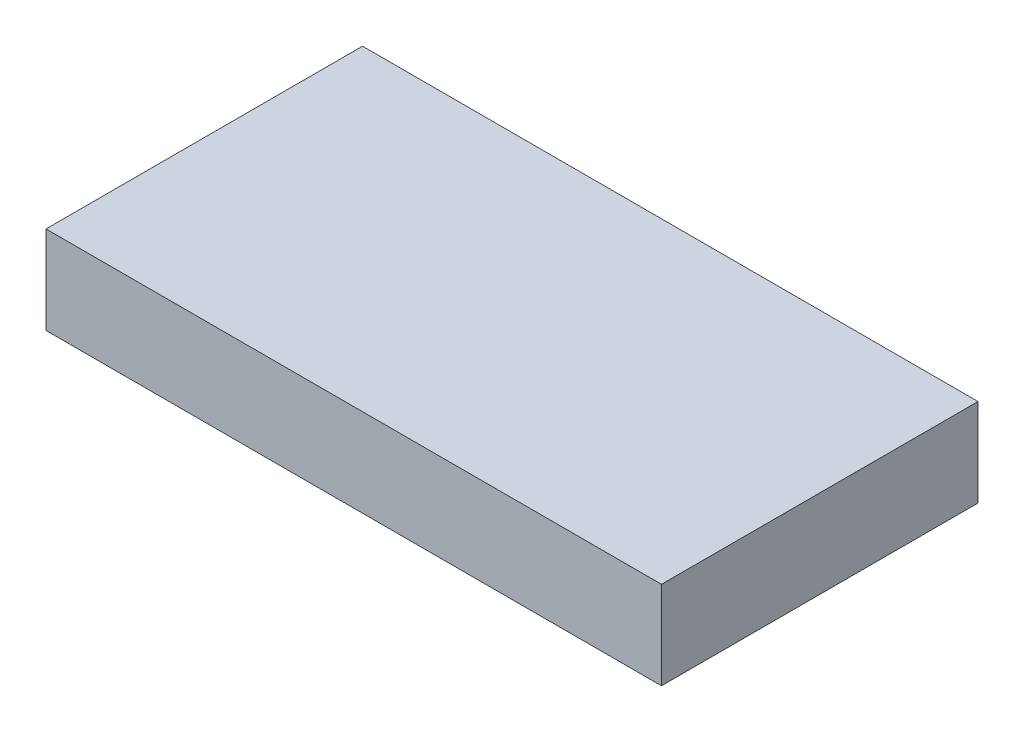
from build123d import *

# Parameters (mm, degrees)
SKETCH1_W           = 35
SKETCH1_H           = 18
BOSS_EXTRUDE1_DEPTH = 5


with BuildPart() as part:
    # Sketch1 → Boss-Extrude1 (new body)
    with BuildSketch(Plane(origin=(0, 0, 0), x_dir=(1, 0, 0), z_dir=(0, 1, 0))):
        Rectangle(SKETCH1_W, SKETCH1_H)
    extrude(amount=BOSS_EXTRUDE1_DEPTH)


solid = part.part
